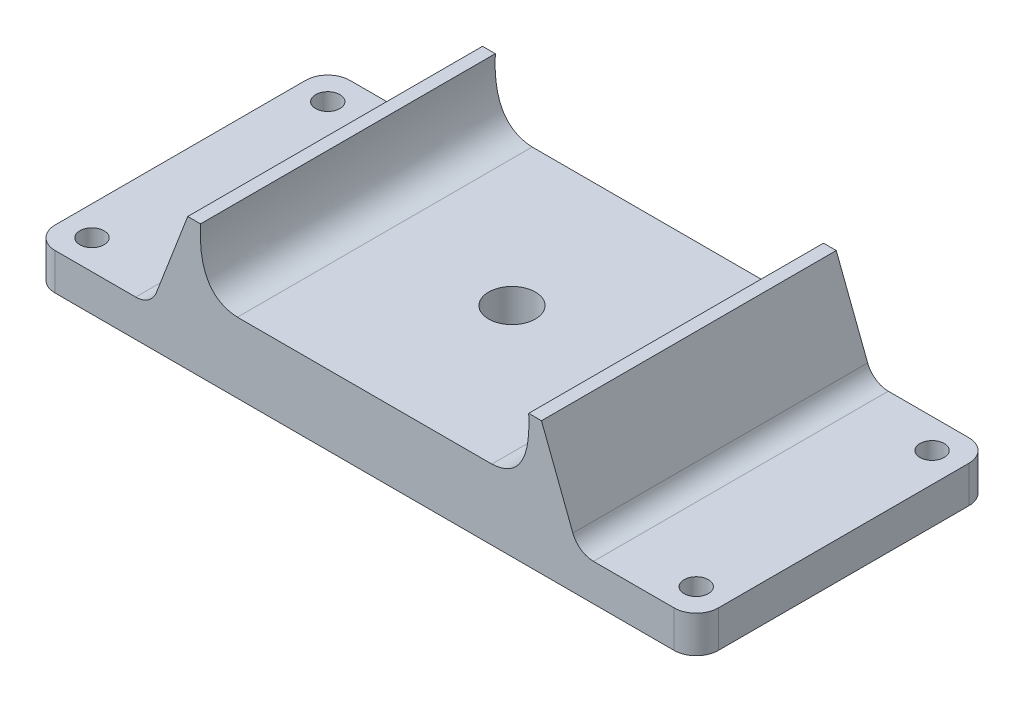
from build123d import *

# Parameters (mm, degrees)
CROQUIS1_W                = 21
CROQUIS1_H                = 40
CROQUIS1_R                = 1.65
SALIENTE_EXTRUIR1_DEPTH   = 5
SALIENTE_EXTRUIR1_2_DEPTH = 5
CROQUIS1_3_W              = 48
CROQUIS1_3_H              = 40
CROQUIS1_3_R              = 3.175
SALIENTE_EXTRUIR2_DEPTH   = 18
CORTAR_EXTRUIR1_DEPTH     = 52
CHAFL_N1_SIZE2            = 13
CHAFL_N1_SIZE             = 5
CHAFL_N2_SIZE2            = 13
CHAFL_N2_SIZE             = 5
REDONDEO1_R               = 3
REDONDEO2_R               = 3


with BuildPart() as part:
    # Croquis1 → Saliente-Extruir1 (new body)
    with BuildSketch(Plane(origin=(0, 0, 0), x_dir=(1, 0, 0), z_dir=(0, 1, 0))):
        with Locations((-34.5, 0)):
            Rectangle(CROQUIS1_W, CROQUIS1_H)
        with Locations(Location((-41, -16, 0), (0, 0, 270))):
            Circle(CROQUIS1_R, mode=Mode.SUBTRACT)
        with Locations(Location((-41, 16, 0), (0, 0, 270))):
            Circle(CROQUIS1_R, mode=Mode.SUBTRACT)
    extrude(amount=SALIENTE_EXTRUIR1_DEPTH)



with BuildPart() as body_2:
    # Croquis1 → Saliente-Extruir1 2 (new body)
    with BuildSketch(Plane(origin=(0, 0, 0), x_dir=(1, 0, 0), z_dir=(0, 1, 0))):
        with Locations((34.5, 0)):
            Rectangle(CROQUIS1_W, CROQUIS1_H)
        with Locations(Location((41, -16, 0), (0, 0, 270))):
            Circle(CROQUIS1_R, mode=Mode.SUBTRACT)
        with Locations(Location((41, 16, 0), (0, 0, 270))):
            Circle(CROQUIS1_R, mode=Mode.SUBTRACT)
    extrude(amount=SALIENTE_EXTRUIR1_2_DEPTH)


with BuildPart() as part_1:
    add(part.part)

    add(body_2.part)  # Saliente-Extruir2 merges body 2
    # Croquis1<3> → Saliente-Extruir2 (add)
    with BuildSketch(Plane(origin=(0, 0, 0), x_dir=(1, 0, 0), z_dir=(0, 1, 0))):
        Rectangle(CROQUIS1_3_W, CROQUIS1_3_H)
        with Locations(Location((0, 0, 0), (0, 0, 270))):
            Circle(CROQUIS1_3_R, mode=Mode.SUBTRACT)
    extrude(amount=SALIENTE_EXTRUIR2_DEPTH)

    # Croquis2 → Cortar-Extruir1 (cut)
    with BuildSketch(Plane.XY.offset(20)):
        with BuildLine():
            Line((-17.262904506, 9.533811896), (17.262904506, 9.533811896))
            add(Edge.make_bspline(
                [(22.266442187, 18), (22.701537977, 9.819720853), (17.262904506, 9.533811896)],
                knots=[0, 0, 0, 1, 1, 1], degree=2))
            Line((22.266442187, 18), (-22.266442187, 18))
            add(Edge.make_bspline(
                [(-22.266442187, 18), (-22.701537977, 9.819720853), (-17.262904506, 9.533811896)],
                knots=[0, 0, 0, 1, 1, 1], degree=2))
        make_face()
    extrude(amount=-CORTAR_EXTRUIR1_DEPTH, mode=Mode.SUBTRACT)

    # Chaflán1
    chafl_n1_edges = [part_1.edges().sort_by_distance(p)[0] for p in [
        (-24, 5, 0),
    ]]
    chafl_n1_side = [part_1.faces().sort_by_distance(p)[0] for p in [
        (-24.1, 5, 0),
    ]]
    chamfer(chafl_n1_edges, length=CHAFL_N1_SIZE - 0.0001, length2=CHAFL_N1_SIZE2 - 0.0001, reference=chafl_n1_side[0])  # a hair under: the kernel refuses the full size

    # Chaflán2
    chafl_n2_edges = [part_1.edges().sort_by_distance(p)[0] for p in [
        (24, 5, 0),
    ]]
    chafl_n2_side = [part_1.faces().sort_by_distance(p)[0] for p in [
        (24.1, 5, 0),
    ]]
    chamfer(chafl_n2_edges, length=CHAFL_N2_SIZE - 0.0001, length2=CHAFL_N2_SIZE2 - 0.0001, reference=chafl_n2_side[0])  # a hair under: the kernel refuses the full size

    # Redondeo1
    redondeo1_edges = [part_1.edges().sort_by_distance(p)[0] for p in [
        (-28.9999, 5, 0),
        (28.9999, 5, 0),
    ]]
    fillet(redondeo1_edges, radius=REDONDEO1_R)

    # Redondeo2
    redondeo2_edges = [part_1.edges().sort_by_distance(p)[0] for p in [
        (-45, 2.5, 20),
        (-45, 2.5, -20),
        (45, 2.5, -20),
        (45, 2.5, 20),
    ]]
    fillet(redondeo2_edges, radius=REDONDEO2_R)


solid = part_1.part
